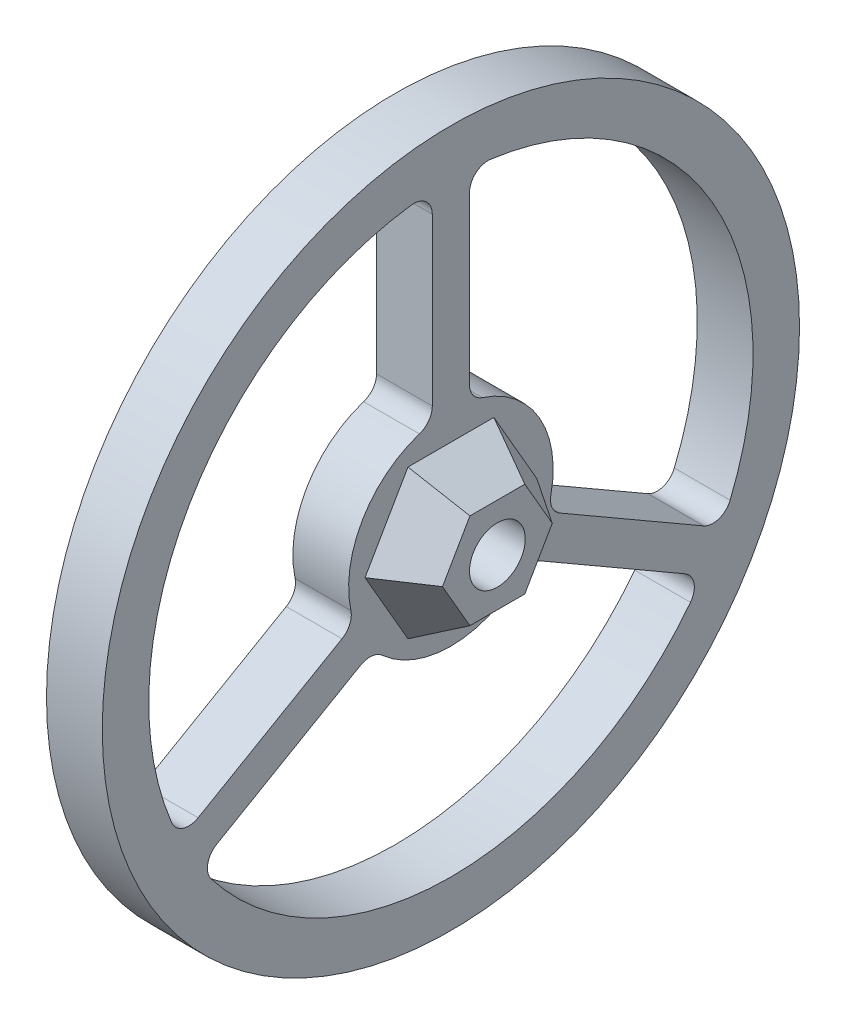
from build123d import *

# Parameters (mm, degrees)
SKETCH1_R           = 37.5
SKETCH1_R_2         = 3
BOSS_EXTRUDE1_DEPTH = 6
FILLET1_R           = 2
BOSS_EXTRUDE2_DEPTH = 5
BOSS_EXTRUDE2_TAPER = 30
SKETCH1_6_R         = 3
CUT_EXTRUDE1_DEPTH  = 20


with BuildPart() as part:
    # Sketch1 → Boss-Extrude1 (new body)
    with BuildSketch(Plane(origin=(0, 0, 0), x_dir=(0, 0, -1), z_dir=(1, 0, 0))):
        Circle(SKETCH1_R)
        with BuildLine():
            Line((2, 10.816653826), (2, 32.438403167))
            ThreePointArc((2, 32.438403167), (28.145825623, 16.25), (29.0924812, -14.487150776))
            Line((29.0924812, -14.487150776), (10.367496998, -3.676276106))
            ThreePointArc((10.367496998, -3.676276106), (9.526279442, 5.5), (2, 10.816653826))
        make_face(mode=Mode.SUBTRACT)
        with BuildLine():
            ThreePointArc((-8.367496998, -7.140377721), (0, -11), (8.367496998, -7.140377721))
            Line((8.367496998, -7.140377721), (27.0924812, -17.951252391))
            ThreePointArc((27.0924812, -17.951252391), (0, -32.5), (-27.0924812, -17.951252391))
            Line((-27.0924812, -17.951252391), (-8.367496998, -7.140377721))
        make_face(mode=Mode.SUBTRACT)
        with BuildLine():
            ThreePointArc((-2, 10.816653826), (-9.526279442, 5.5), (-10.367496998, -3.676276106))
            Line((-10.367496998, -3.676276106), (-29.0924812, -14.487150776))
            ThreePointArc((-29.0924812, -14.487150776), (-28.145825623, 16.25), (-2, 32.438403167))
            Line((-2, 32.438403167), (-2, 10.816653826))
        make_face(mode=Mode.SUBTRACT)
        Circle(SKETCH1_R_2, mode=Mode.SUBTRACT)
    extrude(amount=BOSS_EXTRUDE1_DEPTH)

    # Fillet1
    fillet1_edges = [part.edges().sort_by_distance(p)[0] for p in [
        (3, -3.676276106, 10.367496998),
        (3, -7.140377721, 8.367496998),
        (3, -7.140377721, -8.367496998),
        (3, -3.676276106, -10.367496998),
        (3, 10.816653826, -2),
        (3, -17.951252391, -27.0924812),
        (3, -14.487150776, -29.0924812),
        (3, -17.951252391, 27.0924812),
        (3, -14.487150776, 29.0924812),
        (3, 32.438403167, -2),
        (3, 32.438403167, 2),
        (3, 10.816653826, 2),
    ]]
    fillet(fillet1_edges, radius=FILLET1_R)

    # Sketch2 → Boss-Extrude2 (add)
    with BuildSketch(Plane(origin=(6, 0, 0), x_dir=(0, 0, -1), z_dir=(1, 0, 0))):
        Polygon((9.237604307, 0), (4.618802154, 8), (-4.618802154, 8), (-9.237604307, 0), (-4.618802154, -8), (4.618802154, -8), align=None)
    extrude(amount=BOSS_EXTRUDE2_DEPTH, taper=BOSS_EXTRUDE2_TAPER)

    # Sketch1<6> → Cut-Extrude1 (cut)
    with BuildSketch(Plane(origin=(0, 0, 0), x_dir=(0, 0, -1), z_dir=(1, 0, 0))):
        Circle(SKETCH1_6_R)
    extrude(amount=CUT_EXTRUDE1_DEPTH, mode=Mode.SUBTRACT)


solid = part.part
